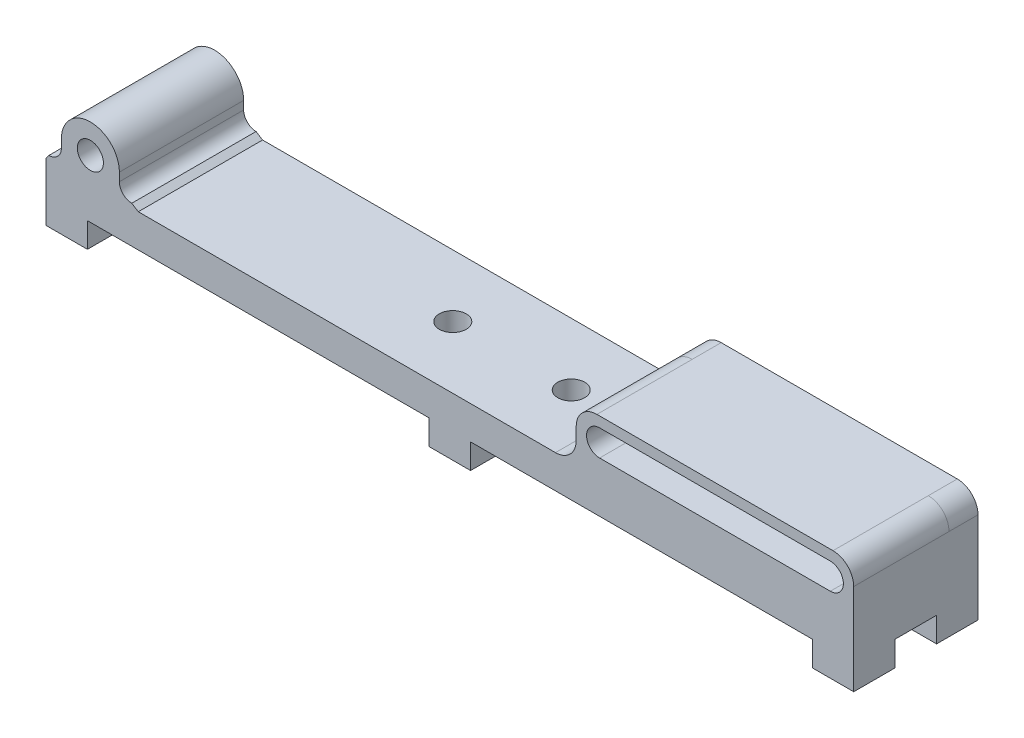
from build123d import *

# Parameters (mm, degrees)
SKETCH1_W           = 195
SKETCH1_H           = 30
BOSS_EXTRUDE1_DEPTH = 8
SKETCH2_W           = 12
SKETCH2_H           = 30
BOSS_EXTRUDE2_DEPTH = 12
SKETCH4_R           = 3.15
CUT_EXTRUDE1_DEPTH  = 199.305320151
FILLET1_R           = 4
FILLET2_R           = 6
BOSS_EXTRUDE4_DEPTH = 30
SKETCH15_W          = 67
SKETCH15_H          = 7
BOSS_EXTRUDE6_DEPTH = 13
SKETCH16_W          = 62
SKETCH16_H          = 6.3
CUT_EXTRUDE4_DEPTH  = 199.408669165
FILLET6_R           = 5
FILLET7_R           = 5
SKETCH17_W          = 10
SKETCH17_H          = 30
BOSS_EXTRUDE7_DEPTH = 6
FILLET8_R           = 3.15
FILLET9_R           = 5
SKETCH20_R          = 3.15
BOSS_EXTRUDE8_DEPTH = 16
SKETCH21_W          = 10
SKETCH21_H          = 30
BOSS_EXTRUDE9_DEPTH = 6
SKETCH22_W          = 10
SKETCH22_H          = 10
CUT_EXTRUDE5_DEPTH  = 6
FILLET10_R          = 5
FILLET11_R          = 3.15
SKETCH23_R          = 3.25
CUT_EXTRUDE6_DEPTH  = 199.408669165


with BuildPart() as part:
    # Sketch1 → Boss-Extrude1 (new body)
    with BuildSketch(Plane(origin=(0, 0, 0), x_dir=(1, 0, 0), z_dir=(0, 1, 0))):
        with Locations((97.5, 15)):
            Rectangle(SKETCH1_W, SKETCH1_H)
    extrude(amount=BOSS_EXTRUDE1_DEPTH)

    # Sketch2 → Boss-Extrude2 (add)
    with BuildSketch(Plane(origin=(0, 8, 0), x_dir=(1, 0, 0), z_dir=(0, 1, 0))):
        with Locations((10.715252385, 15)):
            Rectangle(SKETCH2_W, SKETCH2_H)
    extrude(amount=BOSS_EXTRUDE2_DEPTH)

    # Sketch4 → Cut-Extrude1 (cut, through all)
    with BuildSketch(Plane(origin=(0, 0, -30), x_dir=(-1, 0, 0), z_dir=(0, 0, -1))):
        with Locations((-10.715252385, 14)):
            Circle(SKETCH4_R)
    extrude(amount=-CUT_EXTRUDE1_DEPTH, mode=Mode.SUBTRACT)

    # Fillet1
    fillet1_edges = [part.edges().sort_by_distance(p)[0] for p in [
        (4.715252385, 8, -15),
        (16.715252385, 8, -15),
    ]]
    fillet(fillet1_edges, radius=FILLET1_R)

    # Fillet2
    fillet2_edges = [part.edges().sort_by_distance(p)[0] for p in [
        (4.715252385, 20, -15),
        (16.715252385, 20, -15),
    ]]
    fillet(fillet2_edges, radius=FILLET2_R - 0.0001)  # a hair under: the kernel refuses the full size

    # Sketch11 → Boss-Extrude4 (add)
    with BuildSketch(Plane(origin=(0, 0, -30), x_dir=(-1, 0, 0), z_dir=(0, 0, -1))):
        with BuildLine():
            Line((-16.715252385, 14), (-16.715252385, 12))
            ThreePointArc((-16.715252385, 12), (-17.88682526, 9.171572875), (-20.715252385, 8))
            Line((-20.715252385, 8), (-22.27876013, 8))
            Line((-22.27876013, 8), (-20.715252385, 9))
            ThreePointArc((-20.715252385, 9), (-18.593932042, 9.878679656), (-17.715252385, 12))
            Line((-17.715252385, 12), (-17.715252385, 14))
            ThreePointArc((-17.715252385, 14), (-15.664999853, 18.949747468), (-10.715252385, 21))
            ThreePointArc((-10.715252385, 21), (-5.765504917, 18.949747468), (-3.715252385, 14))
            Line((-3.715252385, 14), (-3.715252385, 12))
            ThreePointArc((-3.715252385, 12), (-2.836572729, 9.878679656), (-0.715252385, 9))
            Line((-0.715252385, 9), (0, 8))
            Line((0, 8), (-0.715252385, 8))
            ThreePointArc((-0.715252385, 8), (-3.54367951, 9.171572875), (-4.715252385, 12))
            Line((-4.715252385, 12), (-4.715252385, 14))
            ThreePointArc((-4.715252385, 14), (-6.472611698, 18.242640687), (-10.715252385, 20))
            ThreePointArc((-10.715252385, 20), (-14.957893072, 18.242640687), (-16.715252385, 14))
        make_face()
    extrude(amount=-BOSS_EXTRUDE4_DEPTH)

    # Sketch15 → Boss-Extrude6 (add)
    with BuildSketch(Plane(origin=(0, 8, 0), x_dir=(1, 0, 0), z_dir=(0, 1, 0))):
        with Locations((161.5, 26.5)):
            Rectangle(SKETCH15_W, SKETCH15_H)
        with Locations((161.5, 3.5)):
            Rectangle(SKETCH15_W, SKETCH15_H)
    extrude(amount=BOSS_EXTRUDE6_DEPTH)

    # Sketch16 → Cut-Extrude4 (cut, through all)
    with BuildSketch(Plane(origin=(0, 0, -30), x_dir=(-1, 0, 0), z_dir=(0, 0, -1))):
        with Locations((-161.5, 15.35)):
            Rectangle(SKETCH16_W, SKETCH16_H)
    extrude(amount=-CUT_EXTRUDE4_DEPTH, mode=Mode.SUBTRACT)

    # Fillet6
    fillet6_edges = [part.edges().sort_by_distance(p)[0] for p in [
        (195, 21, -26.5),
        (128, 21, -26.5),
    ]]
    fillet(fillet6_edges, radius=FILLET6_R)

    # Fillet7
    fillet7_edges = [part.edges().sort_by_distance(p)[0] for p in [
        (128, 8, -26.5),
    ]]
    fillet(fillet7_edges, radius=FILLET7_R)

    # Sketch17 → Boss-Extrude7 (add)
    with BuildSketch(Plane.XZ):
        with Locations((97.5, -15)):
            Rectangle(SKETCH17_W, SKETCH17_H)
    extrude(amount=BOSS_EXTRUDE7_DEPTH)

    # Fillet8
    fillet8_edges = [part.edges().sort_by_distance(p)[0] for p in [
        (192.5, 18.5, -3.5),
        (192.5, 12.2, -3.5),
        (130.5, 18.5, -3.5),
        (130.5, 12.2, -3.5),
    ]]
    fillet(fillet8_edges, radius=FILLET8_R - 0.0001)  # a hair under: the kernel refuses the full size

    # Fillet9
    fillet9_edges = [part.edges().sort_by_distance(p)[0] for p in [
        (128, 8, -3.5),
    ]]
    fillet(fillet9_edges, radius=FILLET9_R)

    # Sketch20 → Boss-Extrude8 (add)
    with BuildSketch(Plane.XY.offset(-23)):
        with BuildLine():
            Line((195, 0), (195, 21))
            Line((195, 21), (128, 21))
            Line((128, 21), (128, 13))
            ThreePointArc((128, 13), (126.535533906, 9.464466094), (123, 8))
            Line((123, 8), (22.27876013, 8))
            Line((22.27876013, 8), (20.715252385, 9))
            ThreePointArc((20.715252385, 9), (18.593932042, 9.878679656), (17.715252385, 12))
            Line((17.715252385, 12), (17.715252385, 14))
            ThreePointArc((17.715252385, 14), (10.715252385, 21), (3.715252385, 14))
            Line((3.715252385, 14), (3.715252385, 12))
            ThreePointArc((3.715252385, 12), (2.836572729, 9.878679656), (0.715252385, 9))
            Line((0.715252385, 9), (0, 8))
            Line((0, 8), (0, 0))
            Line((0, 0), (92.5, 0))
            Line((92.5, 0), (92.5, -6))
            Line((92.5, -6), (102.5, -6))
            Line((102.5, -6), (102.5, 0))
            Line((102.5, 0), (195, 0))
        make_face()
        with Locations(Location((10.715252385, 14, 0), (0, 0, 180))):
            Circle(SKETCH20_R, mode=Mode.SUBTRACT)
        with BuildLine():
            Line((133.65, 12.2), (189.35, 12.2))
            ThreePointArc((189.35, 12.2), (191.577386361, 13.122613639), (192.5, 15.35))
            ThreePointArc((192.5, 15.35), (191.577386361, 17.577386361), (189.35, 18.5))
            Line((189.35, 18.5), (133.65, 18.5))
            ThreePointArc((133.65, 18.5), (131.422613639, 17.577386361), (130.5, 15.35))
            ThreePointArc((130.5, 15.35), (131.422613639, 13.122613639), (133.65, 12.2))
        make_face(mode=Mode.SUBTRACT)
    extrude(amount=BOSS_EXTRUDE8_DEPTH)

    # Sketch21 → Boss-Extrude9 (add)
    with BuildSketch(Plane(origin=(0, 0, 0), x_dir=(-1, 0, 0), z_dir=(0, -1, 0))):
        with Locations((-5, 15)):
            Rectangle(SKETCH21_W, SKETCH21_H)
        with Locations((-190, 15)):
            Rectangle(SKETCH21_W, SKETCH21_H)
    extrude(amount=BOSS_EXTRUDE9_DEPTH)

    # Sketch22 → Cut-Extrude5 (cut)
    with BuildSketch(Plane(origin=(0, -6, 0), x_dir=(-1, 0, 0), z_dir=(0, -1, 0))):
        with Locations((-5, 15)):
            Rectangle(SKETCH22_W, SKETCH22_H)
        with Locations((-97.5, 15)):
            Rectangle(SKETCH22_W, SKETCH22_H)
        with Locations((-190, 15)):
            Rectangle(SKETCH22_W, SKETCH22_H)
    extrude(amount=-CUT_EXTRUDE5_DEPTH, mode=Mode.SUBTRACT)

    # Fillet10
    fillet10_edges = [part.edges().sort_by_distance(p)[0] for p in [
        (128, 21, -11.5),
        (195, 21, -11.5),
    ]]
    fillet(fillet10_edges, radius=FILLET10_R)

    # Fillet11
    fillet11_edges = [part.edges().sort_by_distance(p)[0] for p in [
        (130.5, 18.5, -26.5),
        (130.5, 12.2, -26.5),
        (192.5, 12.2, -26.5),
        (192.5, 18.5, -26.5),
    ]]
    fillet(fillet11_edges, radius=FILLET11_R - 0.0001)  # a hair under: the kernel refuses the full size

    # Sketch23 → Cut-Extrude6 (cut, through all)
    with BuildSketch(Plane.XZ):
        with Locations(Location((83.2, -15, 0), (0, 0, 270))):
            Circle(SKETCH23_R)
        with Locations(Location((111.8, -15, 0), (0, 0, 270))):
            Circle(SKETCH23_R)
    extrude(amount=-CUT_EXTRUDE6_DEPTH, mode=Mode.SUBTRACT)


solid = part.part
